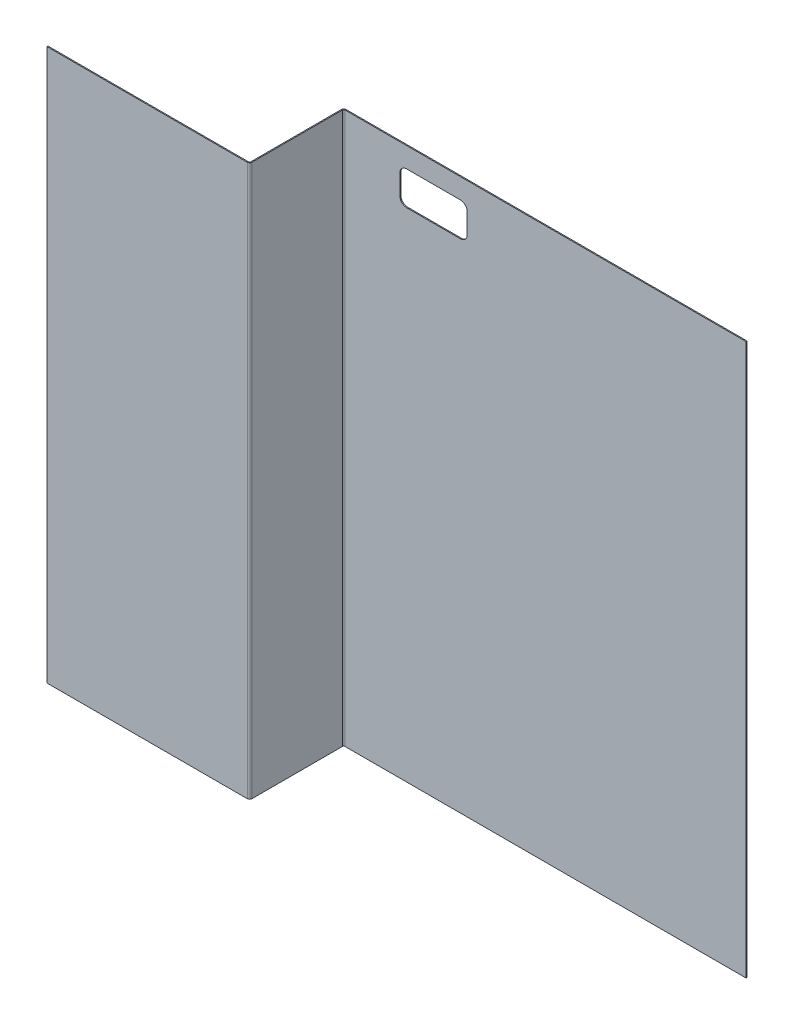
from build123d import *

# Parameters (mm, degrees)
SKETCH1_W                    = 300
SKETCH1_H                    = 820
BOSS_EXTRUDE1_DEPTH          = 2
CONVERT_SOLID1_OUTLINE_W     = 300
CONVERT_SOLID1_OUTLINE_H     = 820
CONVERT_SOLID1_DEPTH         = 0.5
EDGE_FLANGE1_STRIP_W         = 10
EDGE_FLANGE1_STRIP_H         = 1.5
EDGE_FLANGE1_STRIP_CUT_DEPTH = 820
EDGE_FLANGE1_DEPTH           = 820
EDGE_FLANGE2_STRIP_W         = 10
EDGE_FLANGE2_STRIP_H         = 1.5
EDGE_FLANGE2_STRIP_CUT_DEPTH = 820
EDGE_FLANGE2_DEPTH           = 820
CUT_EXTRUDE1_DEPTH           = 1226.561095988


# Read off the part's stored shape, not the designer's step: Convert-Solid1
# Sheet-metal steps are written as plain solids
with BuildPart() as part:
    # Sketch1 → Boss-Extrude1 (new body)
    with BuildSketch(Plane.XY):
        with Locations((150, 410)):
            Rectangle(SKETCH1_W, SKETCH1_H)
    extrude(amount=BOSS_EXTRUDE1_DEPTH)

    # Convert-Solid1 outline → Convert-Solid1 (cut)
    with BuildSketch(Plane.XY):
        with Locations((150, 410)):
            Rectangle(CONVERT_SOLID1_OUTLINE_W, CONVERT_SOLID1_OUTLINE_H)
    extrude(amount=CONVERT_SOLID1_DEPTH, mode=Mode.SUBTRACT)

    # Edge-Flange1 strip (across the edge) → Edge-Flange1 strip cut (cut)
    with BuildSketch(Plane(origin=(300, 820, 0.5), x_dir=(-1, 0, 0), z_dir=(0, -1, 0))):
        with Locations((-3, -0.75)):
            Rectangle(EDGE_FLANGE1_STRIP_W, EDGE_FLANGE1_STRIP_H)
    extrude(amount=EDGE_FLANGE1_STRIP_CUT_DEPTH, mode=Mode.SUBTRACT)

    # Edge-Flange1 section (across the edge) → Edge-Flange1 (add)
    with BuildSketch(Plane(origin=(300, 820, 0.5), x_dir=(-1, 0, 0), z_dir=(0, -1, 0))):
        with BuildLine():
            Line((-1.5, 2), (-1.5, 138.5))
            Line((-1.5, 138.5), (0, 138.5))
            Line((0, 138.5), (0, 2))
            ThreePointArc((0, 2), (0.585786438, 0.585786438), (2, 0))
            Line((2, 0), (2, -1.5))
            ThreePointArc((2, -1.5), (-0.474873734, -0.474873734), (-1.5, 2))
        make_face()
    extrude(amount=EDGE_FLANGE1_DEPTH)

    # Edge-Flange2 strip (across the edge) → Edge-Flange2 strip cut (cut)
    with BuildSketch(Plane(origin=(301.5, 0, -138), x_dir=(0, 0, 1), z_dir=(0, 1, 0))):
        with Locations((-3, -0.75)):
            Rectangle(EDGE_FLANGE2_STRIP_W, EDGE_FLANGE2_STRIP_H)
    extrude(amount=EDGE_FLANGE2_STRIP_CUT_DEPTH, mode=Mode.SUBTRACT)

    # Edge-Flange2 section (across the edge) → Edge-Flange2 (add)
    with BuildSketch(Plane(origin=(301.5, 0, -138), x_dir=(0, 0, 1), z_dir=(0, 1, 0))):
        with BuildLine():
            Line((-1.5, 2), (-1.5, 598.5))
            Line((-1.5, 598.5), (0, 598.5))
            Line((0, 598.5), (0, 2))
            ThreePointArc((0, 2), (0.585786438, 0.585786438), (2, 0))
            Line((2, 0), (2, -1.5))
            ThreePointArc((2, -1.5), (-0.474873734, -0.474873734), (-1.5, 2))
        make_face()
    extrude(amount=EDGE_FLANGE2_DEPTH)

    # Sketch12 → Cut-Extrude1 (cut, through all)
    with BuildSketch(Plane.XY.offset(-138)):
        with BuildLine():
            Line((395.117398745, 789.936561894), (475.117398745, 789.936561894))
            ThreePointArc((475.117398745, 789.936561894), (482.188466557, 787.007629706), (485.117398745, 779.936561894))
            Line((485.117398745, 779.936561894), (485.117398745, 749.936561894))
            ThreePointArc((485.117398745, 749.936561894), (482.188466557, 742.865494082), (475.117398745, 739.936561894))
            Line((475.117398745, 739.936561894), (395.117398745, 739.936561894))
            ThreePointArc((395.117398745, 739.936561894), (388.046330933, 742.865494082), (385.117398745, 749.936561894))
            Line((385.117398745, 749.936561894), (385.117398745, 779.936561894))
            ThreePointArc((385.117398745, 779.936561894), (388.046330933, 787.007629706), (395.117398745, 789.936561894))
        make_face()
    extrude(amount=-CUT_EXTRUDE1_DEPTH, mode=Mode.SUBTRACT)


solid = part.part
